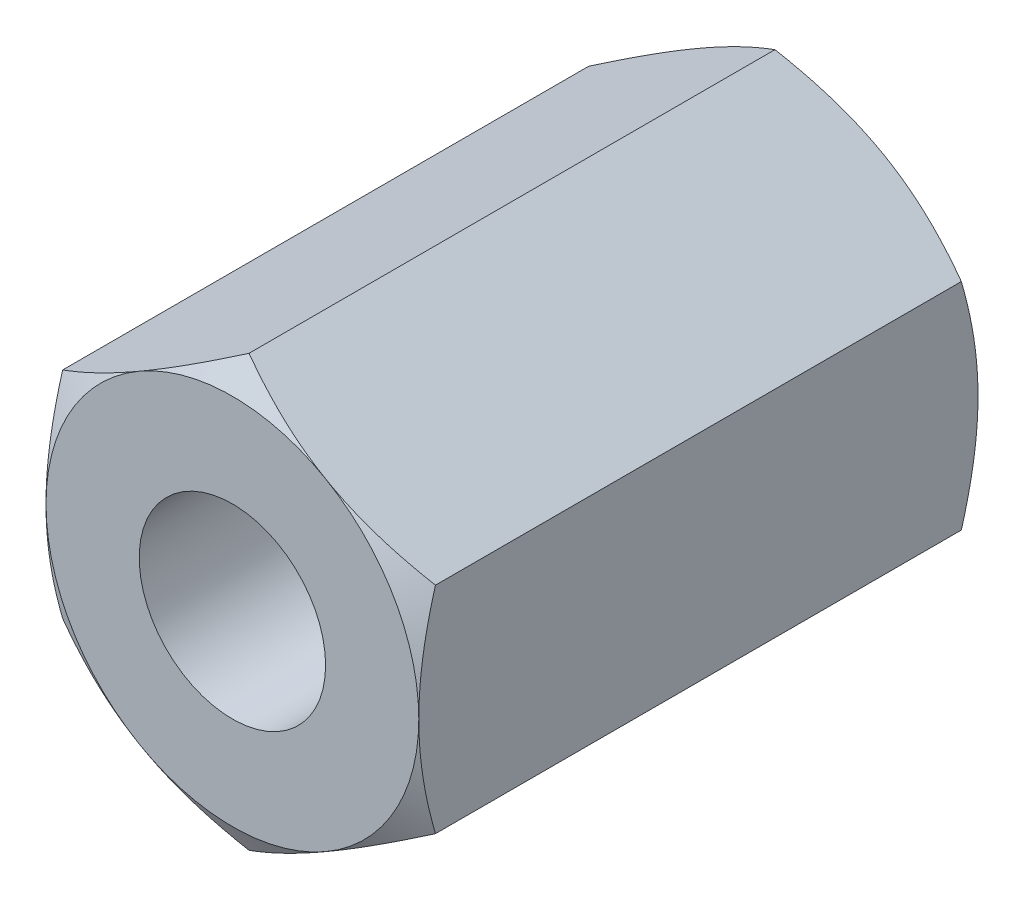
from build123d import *

# Parameters (mm, degrees)
BOSS_EXTRUDE1_DEPTH      = 4.5
BOSS_EXTRUDE1_DEPTH_BACK = 4.5
SKETCH3_R                = 1.5


# Read off the part's stored shape, not the designer's step: Cut-Extrude1
with BuildPart() as part:
    # Sketch3 → Boss-Extrude1 (new, two sides: drawn at the far end of the back side and taken through both)
    with BuildSketch(Plane.XY.offset(-BOSS_EXTRUDE1_DEPTH_BACK)):
        Polygon((0, 3.464101615), (-3, 1.732050808), (-3, -1.732050808), (0, -3.464101615), (3, -1.732050808), (3, 1.732050808), align=None)
        Circle(SKETCH3_R, mode=Mode.SUBTRACT)
    extrude(amount=BOSS_EXTRUDE1_DEPTH + BOSS_EXTRUDE1_DEPTH_BACK)

    # Cut-Extrude1 outline → Cut-Extrude1 (revolve, cut)
    with BuildSketch(Plane.XZ):
        Polygon((3.464101616, 4.5), (3, 4.5), (3.464101609, 4.232050811), align=None)
    cut_extrude1 = revolve(axis=Axis((0, 0, 0), (0, 0, 1)), mode=Mode.SUBTRACT)

    # Mirror1: Cut-Extrude1 across plane
    add(cut_extrude1.mirror(Plane.XY), mode=Mode.SUBTRACT)


solid = part.part
